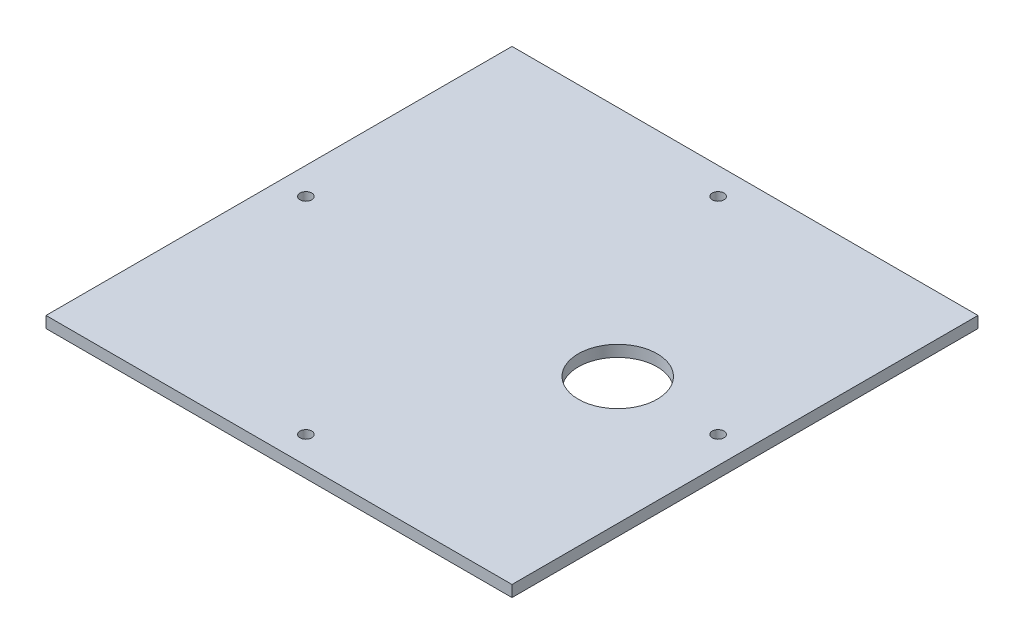
from build123d import *

# Parameters (mm, degrees)
SKETCH1_W           = 130
SKETCH1_H           = 130
SKETCH1_R           = 1.65
SKETCH1_R_2         = 11
BOSS_EXTRUDE1_DEPTH = 3.175


with BuildPart() as part:
    # Sketch1 → Boss-Extrude1 (new body)
    with BuildSketch(Plane(origin=(0, 0, 0), x_dir=(1, 0, 0), z_dir=(0, 1, 0))):
        with Locations((4.465710009, 0)):
            Rectangle(SKETCH1_W, SKETCH1_H)
        with Locations((-53.034289991, 0)):
            Circle(SKETCH1_R, mode=Mode.SUBTRACT)
        with Locations((4.465710009, 57.5)):
            Circle(SKETCH1_R, mode=Mode.SUBTRACT)
        with Locations((61.965710009, 0)):
            Circle(SKETCH1_R, mode=Mode.SUBTRACT)
        with Locations((4.465710009, -57.5)):
            Circle(SKETCH1_R, mode=Mode.SUBTRACT)
        with Locations((33.965710009, 0)):
            Circle(SKETCH1_R_2, mode=Mode.SUBTRACT)
    extrude(amount=BOSS_EXTRUDE1_DEPTH)


solid = part.part
